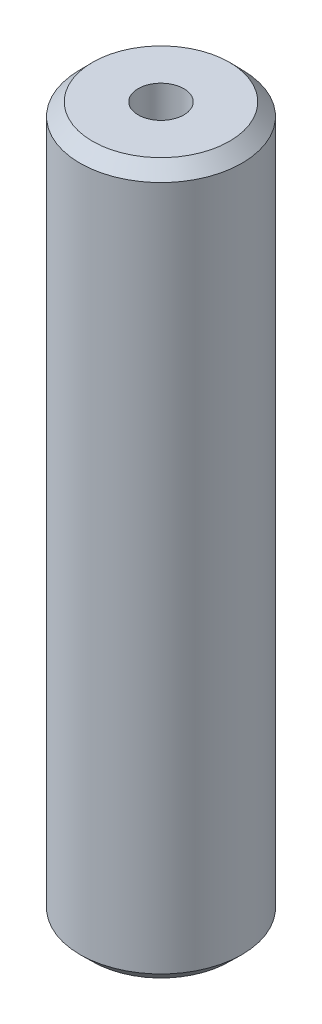
from build123d import *
from OCP.BRepFilletAPI import BRepFilletAPI_MakeChamfer

# Parameters (mm, degrees)
SKETCH1_R           = 5
BOSS_EXTRUDE1_DEPTH = 43.884467982
SKETCH2_R           = 1.40911017
CUT_EXTRUDE1_DEPTH  = 45.450495273
CHAMFER1_SIZE       = 0.786937722
CHAMFER1_SIZE2      = 0.772836197


with BuildPart() as part:
    # Sketch1 → Boss-Extrude1 (new body)
    with BuildSketch(Plane(origin=(0, 0, 0), x_dir=(1, 0, 0), z_dir=(0, 1, 0))):
        Circle(SKETCH1_R)
    extrude(amount=BOSS_EXTRUDE1_DEPTH)

    # Sketch2 → Cut-Extrude1 (cut, through all)
    with BuildSketch(Plane(origin=(0, 0, 0), x_dir=(1, 0, 0), z_dir=(0, 1, 0))):
        Circle(SKETCH2_R)
    extrude(amount=CUT_EXTRUDE1_DEPTH, mode=Mode.SUBTRACT)

    # Chamfer1: one chamfer whose edges measure the first distance from different faces: ONE call of the kernel's chamfer builder (chamfer() names one face for all edges)
    chamfer1_edges_1 = [part.edges().sort_by_distance(p)[0] for p in [
        (-5, 43.884467982, 0),
    ]]
    chamfer1_side_1 = [part.faces().sort_by_distance(p)[0] for p in [
        (-5, 21.942233991, 0),
    ]]
    chamfer1_edges_2 = [part.edges().sort_by_distance(p)[0] for p in [
        (-5, 0, 0),
    ]]
    chamfer1_side_2 = [part.faces().sort_by_distance(p)[0] for p in [
        (-4.858578644, 0, 0),
    ]]
    chamfer1 = BRepFilletAPI_MakeChamfer(part.part.solid().wrapped)
    for e in chamfer1_edges_1:
        chamfer1.Add(CHAMFER1_SIZE, CHAMFER1_SIZE2, e.wrapped, chamfer1_side_1[0].wrapped)  # the first distance lies on this face
    for e in chamfer1_edges_2:
        chamfer1.Add(CHAMFER1_SIZE, CHAMFER1_SIZE2, e.wrapped, chamfer1_side_2[0].wrapped)  # the first distance lies on this face
    add(Compound.cast(chamfer1.Shape()), mode=Mode.REPLACE)


solid = part.part
